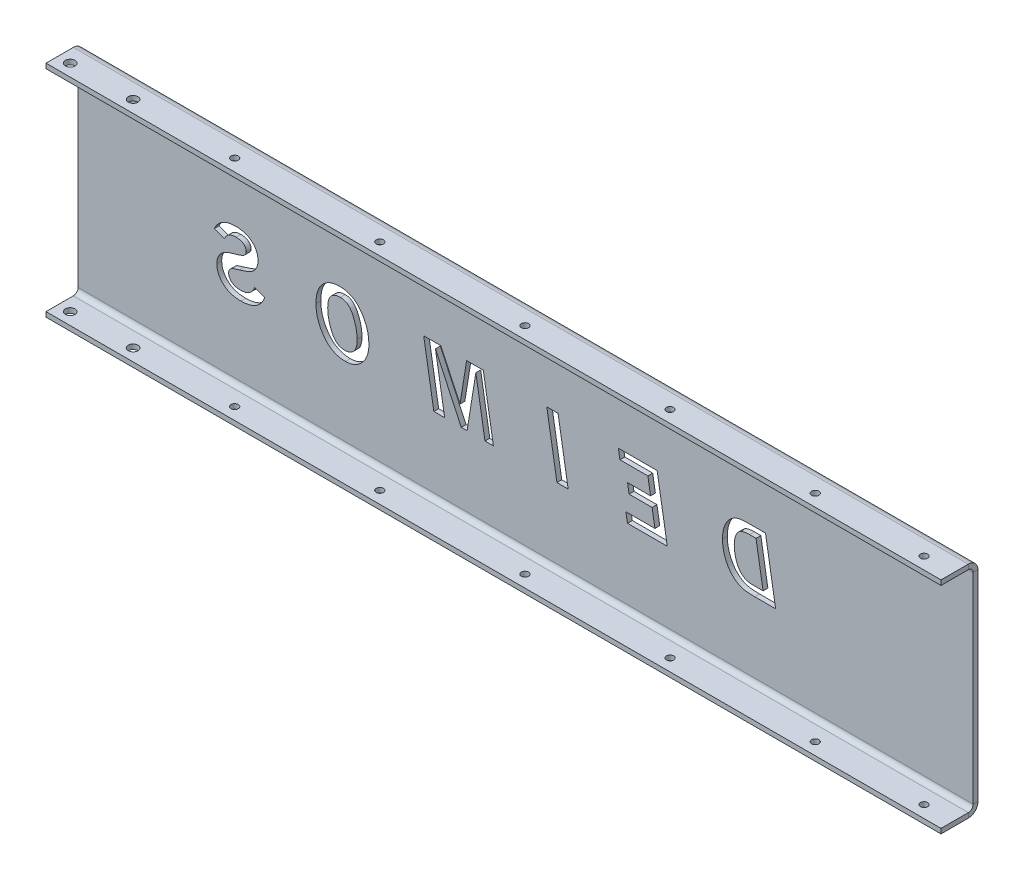
from build123d import *

# Parameters (mm, degrees)
SKETCH1_W                    = 370
SKETCH1_H                    = 114.96
BOSS_EXTRUDE1_DEPTH          = 2
SKETCH6_R                    = 1.5
SKETCH6_R_2                  = 2
CUT_EXTRUDE1_DEPTH           = 2
SKETCHED_START               = 45.05752
SKETCHED_BEND1_OUTLINE_W     = 370
SKETCHED_BEND1_OUTLINE_H     = 2
SKETCHED_BEND1_DEPTH         = 12.42248
SKETCHED_START_2             = -57.48
SKETCHED_BEND1_2_OUTLINE_W   = 370
SKETCHED_BEND1_2_OUTLINE_H   = 2
SKETCHED_BEND1_2_DEPTH       = 12.37752
SKETCHED_START_3             = -43.50248
SKETCHED_BEND1_3_OUTLINE_W   = 370
SKETCHED_BEND1_3_OUTLINE_H   = 13.28761102
SKETCHED_BEND1_3_OUTLINE_R   = 2
SKETCHED_BEND1_3_OUTLINE_R_2 = 1.5
SKETCHED_BEND1_3_DEPTH       = 0.02248
SKETCHED_START_4             = 41.48
SKETCHED_BEND1_4_OUTLINE_W   = 370
SKETCHED_BEND1_4_OUTLINE_H   = 13.28761102
SKETCHED_BEND1_4_OUTLINE_R   = 2
SKETCHED_BEND1_4_OUTLINE_R_2 = 1.5
SKETCHED_BEND1_4_DEPTH       = 4
SKETCHED_START_5             = -45.48
SKETCHED_BEND1_5_OUTLINE_W   = 370
SKETCHED_BEND1_5_OUTLINE_H   = 13.28761102
SKETCHED_BEND1_5_OUTLINE_R   = 2
SKETCHED_BEND1_5_OUTLINE_R_2 = 1.5
SKETCHED_BEND1_5_DEPTH       = 4
SKETCHED_START_6             = -185
SKETCHED_BEND1_6_DEPTH       = 370
CUT_EXTRUDE2_DEPTH           = 10


with BuildPart() as part:
    # Sketch1 → Boss-Extrude1 (new body)
    with BuildSketch(Plane.XY):
        Rectangle(SKETCH1_W, SKETCH1_H)
    extrude(amount=BOSS_EXTRUDE1_DEPTH)

    # Sketch6 → Cut-Extrude1 (cut)
    with BuildSketch(Plane.XY.offset(2)):
        with Locations((-112, 52.48)):
            Circle(SKETCH6_R)
        with Locations((-52, 52.48)):
            Circle(SKETCH6_R)
        with Locations((8, 52.48)):
            Circle(SKETCH6_R)
        with Locations((68, 52.48)):
            Circle(SKETCH6_R)
        with Locations((128, 52.48)):
            Circle(SKETCH6_R)
        with Locations((-180, 52.48)):
            Circle(SKETCH6_R_2)
        with Locations((-154, 52.48)):
            Circle(SKETCH6_R_2)
        with Locations((173, 52.48)):
            Circle(SKETCH6_R)
        with Locations(Location((173, -52.48, 0), (0, 0, 180))):
            Circle(SKETCH6_R)
        with Locations(Location((-154, -52.48, 0), (0, 0, 180))):
            Circle(SKETCH6_R_2)
        with Locations(Location((-180, -52.48, 0), (0, 0, 180))):
            Circle(SKETCH6_R_2)
        with Locations(Location((128, -52.48, 0), (0, 0, 180))):
            Circle(SKETCH6_R)
        with Locations(Location((68, -52.48, 0), (0, 0, 180))):
            Circle(SKETCH6_R)
        with Locations(Location((8, -52.48, 0), (0, 0, 180))):
            Circle(SKETCH6_R)
        with Locations(Location((-52, -52.48, 0), (0, 0, 180))):
            Circle(SKETCH6_R)
        with Locations(Location((-112, -52.48, 0), (0, 0, 180))):
            Circle(SKETCH6_R)
    extrude(amount=-CUT_EXTRUDE1_DEPTH, mode=Mode.SUBTRACT)

    # Sketched Bend1: read off the stored shape, not the designer's step
    # Sketched Bend1 outline → Sketched Bend1 (cut)
    with BuildSketch(Plane(origin=(0, 0, 0), x_dir=(1, 0, 0), z_dir=(0, 1, 0)).offset(SKETCHED_START)):
        with Locations((0, -1)):
            Rectangle(SKETCHED_BEND1_OUTLINE_W, SKETCHED_BEND1_OUTLINE_H)
    extrude(amount=SKETCHED_BEND1_DEPTH, mode=Mode.SUBTRACT)

    # Sketched Bend1 2 outline → Sketched Bend1 2 (cut)
    with BuildSketch(Plane(origin=(0, 0, 0), x_dir=(1, 0, 0), z_dir=(0, 1, 0)).offset(SKETCHED_START_2)):
        with Locations((0, -1)):
            Rectangle(SKETCHED_BEND1_2_OUTLINE_W, SKETCHED_BEND1_2_OUTLINE_H)
    extrude(amount=SKETCHED_BEND1_2_DEPTH, mode=Mode.SUBTRACT)

    # Sketched Bend1 3 outline → Sketched Bend1 3 (add)
    with BuildSketch(Plane(origin=(0, 0, 0), x_dir=(1, 0, 0), z_dir=(0, 1, 0)).offset(SKETCHED_START_3)):
        with Locations((0, -8.64380551)):
            Rectangle(SKETCHED_BEND1_3_OUTLINE_W, SKETCHED_BEND1_3_OUTLINE_H)
        with Locations((-180, -10.28761102)):
            Circle(SKETCHED_BEND1_3_OUTLINE_R, mode=Mode.SUBTRACT)
        with Locations((-154, -10.28761102)):
            Circle(SKETCHED_BEND1_3_OUTLINE_R, mode=Mode.SUBTRACT)
        with Locations((-112, -10.28761102)):
            Circle(SKETCHED_BEND1_3_OUTLINE_R_2, mode=Mode.SUBTRACT)
        with Locations((-52, -10.28761102)):
            Circle(SKETCHED_BEND1_3_OUTLINE_R_2, mode=Mode.SUBTRACT)
        with Locations((8, -10.28761102)):
            Circle(SKETCHED_BEND1_3_OUTLINE_R_2, mode=Mode.SUBTRACT)
        with Locations((68, -10.28761102)):
            Circle(SKETCHED_BEND1_3_OUTLINE_R_2, mode=Mode.SUBTRACT)
        with Locations((128, -10.28761102)):
            Circle(SKETCHED_BEND1_3_OUTLINE_R_2, mode=Mode.SUBTRACT)
        with Locations((173, -10.28761102)):
            Circle(SKETCHED_BEND1_3_OUTLINE_R_2, mode=Mode.SUBTRACT)
    extrude(amount=SKETCHED_BEND1_3_DEPTH)

    # Sketched Bend1 4 outline → Sketched Bend1 4 (add)
    with BuildSketch(Plane(origin=(0, 0, 0), x_dir=(1, 0, 0), z_dir=(0, 1, 0)).offset(SKETCHED_START_4)):
        with Locations((0, -8.64380551)):
            Rectangle(SKETCHED_BEND1_4_OUTLINE_W, SKETCHED_BEND1_4_OUTLINE_H)
        with Locations((-180, -10.28761102)):
            Circle(SKETCHED_BEND1_4_OUTLINE_R, mode=Mode.SUBTRACT)
        with Locations((-154, -10.28761102)):
            Circle(SKETCHED_BEND1_4_OUTLINE_R, mode=Mode.SUBTRACT)
        with Locations((-112, -10.28761102)):
            Circle(SKETCHED_BEND1_4_OUTLINE_R_2, mode=Mode.SUBTRACT)
        with Locations((-52, -10.28761102)):
            Circle(SKETCHED_BEND1_4_OUTLINE_R_2, mode=Mode.SUBTRACT)
        with Locations((8, -10.28761102)):
            Circle(SKETCHED_BEND1_4_OUTLINE_R_2, mode=Mode.SUBTRACT)
        with Locations((68, -10.28761102)):
            Circle(SKETCHED_BEND1_4_OUTLINE_R_2, mode=Mode.SUBTRACT)
        with Locations((128, -10.28761102)):
            Circle(SKETCHED_BEND1_4_OUTLINE_R_2, mode=Mode.SUBTRACT)
        with Locations((173, -10.28761102)):
            Circle(SKETCHED_BEND1_4_OUTLINE_R_2, mode=Mode.SUBTRACT)
    extrude(amount=SKETCHED_BEND1_4_DEPTH)

    # Sketched Bend1 5 outline → Sketched Bend1 5 (add)
    with BuildSketch(Plane(origin=(0, 0, 0), x_dir=(1, 0, 0), z_dir=(0, 1, 0)).offset(SKETCHED_START_5)):
        with Locations((0, -8.64380551)):
            Rectangle(SKETCHED_BEND1_5_OUTLINE_W, SKETCHED_BEND1_5_OUTLINE_H)
        with Locations((-180, -10.28761102)):
            Circle(SKETCHED_BEND1_5_OUTLINE_R, mode=Mode.SUBTRACT)
        with Locations((-154, -10.28761102)):
            Circle(SKETCHED_BEND1_5_OUTLINE_R, mode=Mode.SUBTRACT)
        with Locations((-112, -10.28761102)):
            Circle(SKETCHED_BEND1_5_OUTLINE_R_2, mode=Mode.SUBTRACT)
        with Locations((-52, -10.28761102)):
            Circle(SKETCHED_BEND1_5_OUTLINE_R_2, mode=Mode.SUBTRACT)
        with Locations((8, -10.28761102)):
            Circle(SKETCHED_BEND1_5_OUTLINE_R_2, mode=Mode.SUBTRACT)
        with Locations((68, -10.28761102)):
            Circle(SKETCHED_BEND1_5_OUTLINE_R_2, mode=Mode.SUBTRACT)
        with Locations((128, -10.28761102)):
            Circle(SKETCHED_BEND1_5_OUTLINE_R_2, mode=Mode.SUBTRACT)
        with Locations((173, -10.28761102)):
            Circle(SKETCHED_BEND1_5_OUTLINE_R_2, mode=Mode.SUBTRACT)
    extrude(amount=SKETCHED_BEND1_5_DEPTH)

    # Sketched Bend1 6 outline → Sketched Bend1 6 (cut)
    with BuildSketch(Plane.YZ.offset(SKETCHED_START_6)):
        with BuildLine():
            Line((-41.48, 15.28761102), (-43.48, 15.28761102))
            Line((-43.48, 15.28761102), (-43.48, 4))
            ThreePointArc((-43.48, 4), (-42.894213562, 2.585786438), (-41.48, 2))
            Line((-41.48, 2), (-41.48, 15.28761102))
        make_face()
        with BuildLine():
            Line((-45.10248, 0), (-41.48, 0))
            ThreePointArc((-41.48, 0), (-44.308427125, 1.171572875), (-45.48, 4))
            Line((-45.48, 4), (-45.48, 2))
            Line((-45.48, 2), (-45.10248, 2))
            Line((-45.10248, 2), (-45.10248, 0))
        make_face()
        with BuildLine():
            Line((45.48, 2), (45.48, 4))
            ThreePointArc((45.48, 4), (44.308427125, 1.171572875), (41.48, 0))
            Line((41.48, 0), (45.05752, 0))
            Line((45.05752, 0), (45.05752, 2))
            Line((45.05752, 2), (45.48, 2))
        make_face()
        with BuildLine():
            ThreePointArc((41.48, 2), (42.894213562, 2.585786438), (43.48, 4))
            Line((43.48, 4), (43.48, 15.28761102))
            Line((43.48, 15.28761102), (41.48, 15.28761102))
            Line((41.48, 15.28761102), (41.48, 2))
        make_face()
    extrude(amount=SKETCHED_BEND1_6_DEPTH, mode=Mode.SUBTRACT)

    # Sketch9 → Cut-Extrude2 (cut)
    # profile 1 of 6: a face of its own
    with BuildSketch(Plane(origin=(0, 0, 0), x_dir=(-1, 0, 0), z_dir=(0, 0, -1))):
        with BuildLine():
            Line((-103.333373446, -12.355387634), (-99.150430738, 12.644612366))
            Line((-99.150430738, 12.644612366), (-91.777383863, 12.644612366))
            add(Edge.make_bspline(
                [(-91.777383863, 12.644612366), (-91.372095943, 12.640604528), (-90.602074955, 12.632989893), (-89.507882373, 12.544455465), (-88.536384929, 12.410582481), (-87.667300905, 12.208827265), (-86.86880803, 11.919185976), (-86.102674711, 11.52833503), (-85.352349299, 11.03024478), (-84.618985787, 10.427754808), (-83.92128798, 9.713049323), (-83.294458798, 8.867355234), (-82.743710544, 7.898930135), (-82.257780501, 6.821315334), (-81.851435575, 5.639900668), (-81.579066505, 4.359084196), (-81.39675362, 2.994549803), (-81.380124839, 2.054972557), (-81.37156789, 1.571478686)],
                knots=[0, 0, 0, 0, 1.118870544, 2.125782091, 3.02903713, 3.824810156, 4.584659149, 5.368544991, 6.194019643, 7.066791694, 7.984983464, 8.944777353, 9.964926002, 11.055581011, 12.205220283, 13.407129518, 14.665743566, 16, 16, 16, 16], degree=3))
            add(Edge.make_bspline(
                [(-81.37156789, 1.571478686), (-81.376252418, 1.282045734), (-81.385572665, 0.706195403), (-81.444583045, -0.150618191), (-81.55063267, -0.993666314), (-81.686471101, -1.824796868), (-81.882214569, -2.637211454), (-82.10176863, -3.439233604), (-82.368686634, -4.226984517), (-82.676773761, -4.994879353), (-83.010096617, -5.736116487), (-83.370250794, -6.433902784), (-83.737296231, -7.094298729), (-84.126293506, -7.708341363), (-84.542819875, -8.273221917), (-84.967635639, -8.800402662), (-85.414613033, -9.279878155), (-86.019914425, -9.846209473), (-86.782223702, -10.463239523), (-87.708034062, -11.077662482), (-88.622409362, -11.552732676), (-89.39712994, -11.831123131), (-90.035490434, -11.981819426), (-90.552258527, -12.086841382), (-91.120024363, -12.163726091), (-91.732874198, -12.236113286), (-92.3952409, -12.289427227), (-93.106335072, -12.324609275), (-93.865880554, -12.355687905), (-94.388748179, -12.355489761), (-94.658243238, -12.355387634)],
                knots=[0, 0, 0, 0, 1.109274789, 2.206992162, 3.289307393, 4.364922295, 5.43246829, 6.490182234, 7.550979898, 8.617918265, 9.660145882, 10.664442752, 11.626427069, 12.555076936, 13.447833094, 14.314876134, 15.148533775, 15.957539771, 17.490250216, 18.901208968, 20.209277333, 21.430298952, 22.043860887, 22.722124047, 23.450386116, 24.238732461, 25.087126029, 25.996356372, 26.967287261, 28, 28, 28, 28], degree=3))
            Line((-94.658243238, -12.355387634), (-103.333373446, -12.355387634))
        make_face()
        with BuildLine():
            Line((-98.141316154, -8.535943189), (-94.159111293, -8.535943189))
            add(Edge.make_bspline(
                [(-94.159111293, -8.535943189), (-93.84416243, -8.530392997), (-93.245141008, -8.51983673), (-92.394965034, -8.422722907), (-91.642519384, -8.264936112), (-90.972241325, -8.034079072), (-90.366162201, -7.708185737), (-89.774796569, -7.315378243), (-89.214120241, -6.808498658), (-88.644625843, -6.230643804), (-88.115496016, -5.523169032), (-87.642900599, -4.67873861), (-87.238525838, -3.695411501), (-86.880166271, -2.602258025), (-86.591752116, -1.430582672), (-86.388635831, -0.220738734), (-86.258201146, 1.006206306), (-86.241223264, 1.829760939), (-86.232679001, 2.244221741)],
                knots=[0, 0, 0, 0, 0.996978223, 1.896216764, 2.7049113, 3.42754481, 4.131909927, 4.878381725, 5.669717774, 6.520192559, 7.444427195, 8.457280282, 9.576134715, 10.805702254, 12.097335228, 13.392720083, 14.687864434, 16, 16, 16, 16], degree=3))
            add(Edge.make_bspline(
                [(-86.232679001, 2.244221741), (-86.240554911, 2.570229823), (-86.256022106, 3.210464559), (-86.390955442, 4.143899187), (-86.598124164, 5.031760205), (-86.902294333, 5.854946024), (-87.272005896, 6.608844057), (-87.740886531, 7.251126236), (-88.294360669, 7.774035369), (-88.935617195, 8.18015278), (-89.678940548, 8.471808179), (-90.526899873, 8.680773071), (-91.493611557, 8.802100756), (-92.176694755, 8.817203294), (-92.536932474, 8.825167922)],
                knots=[0, 0, 0, 0, 1.115751648, 2.191181755, 3.223028885, 4.23195157, 5.190170781, 6.089364625, 6.939250992, 7.782751402, 8.671651249, 9.661406867, 10.766695684, 12, 12, 12, 12], degree=3))
            Line((-92.536932474, 8.825167922), (-95.233330043, 8.825167922))
            Line((-95.233330043, 8.825167922), (-98.141316154, -8.535943189))
        make_face(mode=Mode.SUBTRACT)
    # profile 2 of 6: a face of its own
    with BuildSketch(Plane(origin=(0, 0, 0), x_dir=(-1, 0, 0), z_dir=(0, 0, -1))):
        Polygon((-42.102904696, -12.355387634), (-58.541706779, -12.355387634), (-54.358764071, 12.644612366), (-38.316012335, 12.644612366), (-38.977904696, 8.825167922), (-50.533894279, 8.825167922), (-51.635239765, 2.2279457), (-42.135456779, 2.2279457), (-42.75937171, -1.591498745), (-52.27000539, -1.591498745), (-53.436455043, -8.535943189), (-41.441012335, -8.535943189), align=None)
    # profile 3 of 6: a face of its own
    with BuildSketch(Plane(origin=(0, 0, 0), x_dir=(-1, 0, 0), z_dir=(0, 0, -1))):
        Polygon((-12.936238029, -12.355387634), (-17.569484557, -12.355387634), (-13.386541849, 12.644612366), (-8.753295321, 12.644612366), align=None)
    # profile 4 of 6: a face of its own
    with BuildSketch(Plane(origin=(0, 0, 0), x_dir=(-1, 0, 0), z_dir=(0, 0, -1))):
        Polygon((37.953518915, -12.355387634), (33.47218211, -12.355387634), (37.286201207, 10.409369311), (26.63624461, -12.355387634), (24.200263707, -12.355387634), (20.592407804, 10.208631463), (16.816366137, -12.355387634), (13.333293221, -12.355387634), (17.516235929, 12.644612366), (24.411852249, 12.644612366), (27.135376554, -4.287896314), (35.045532804, 12.644612366), (42.141886971, 12.644612366), align=None)
    # profile 5 of 6: a face of its own
    with BuildSketch(Plane(origin=(0, 0, 0), x_dir=(-1, 0, 0), z_dir=(0, 0, -1))):
        with BuildLine():
            add(Edge.make_bspline(
                [(64.808987665, -1.683729648), (64.817213793, -1.222089744), (64.833521756, -0.306907504), (64.998944666, 1.045776381), (65.252276067, 2.366663345), (65.609537215, 3.654022824), (66.076862407, 4.906697791), (66.631711125, 6.132163365), (67.30732679, 7.314784282), (67.936063798, 8.27050368), (68.491276669, 8.997757319), (68.923002828, 9.51635324), (69.381910462, 9.990433785), (69.846552118, 10.440875472), (70.337886581, 10.845802333), (70.840943672, 11.222146041), (71.36546343, 11.55996275), (71.905591233, 11.862099433), (72.462379369, 12.131728264), (73.038700152, 12.35737877), (73.630904365, 12.553166418), (74.2389802, 12.716964204), (74.865985449, 12.842660446), (75.509672225, 12.925929124), (76.170394645, 12.984522579), (76.61621847, 12.989373478), (76.842407804, 12.991834588)],
                knots=[0, 0, 0, 0, 1.573759098, 3.11991309, 4.640401397, 6.157784159, 7.67014454, 9.196388864, 10.740216044, 12.310575267, 13.093905576, 13.859925972, 14.610266845, 15.343167476, 16.065744126, 16.779980783, 17.484835054, 18.191737227, 18.889676342, 19.592909635, 20.300914138, 21.016055667, 21.739395293, 22.479963726, 23.228807494, 24, 24, 24, 24], degree=3))
            add(Edge.make_bspline(
                [(76.842407804, 12.991834588), (77.213670065, 12.984940904), (77.940938554, 12.971436812), (78.999029229, 12.823698028), (79.999696466, 12.602834891), (80.933671555, 12.270326313), (81.811915915, 11.860902857), (82.628629066, 11.351528692), (83.378332163, 10.744316441), (84.068918922, 10.054479533), (84.686967092, 9.285665731), (85.22063319, 8.440907762), (85.680106708, 7.53252566), (86.046246456, 6.550446697), (86.334347851, 5.502851144), (86.539854915, 4.386760385), (86.657508473, 3.201616686), (86.675017946, 2.38915879), (86.683987665, 1.97295438)],
                knots=[0, 0, 0, 0, 1.065001061, 2.086238741, 3.060922607, 4.001671949, 4.925890787, 5.83767763, 6.757043512, 7.689405277, 8.634712547, 9.582297668, 10.552714363, 11.551580765, 12.58556343, 13.667883125, 14.805307533, 16, 16, 16, 16], degree=3))
            add(Edge.make_bspline(
                [(86.683987665, 1.97295438), (86.672889182, 1.500562848), (86.65097465, 0.567801219), (86.496789679, -0.813319007), (86.237239841, -2.152235324), (85.872203004, -3.454023826), (85.397716145, -4.711517445), (84.827603896, -5.935146321), (84.144011002, -7.113514251), (83.373703258, -8.244062089), (82.516325113, -9.286637179), (81.576627081, -10.201357963), (80.570780403, -10.978339445), (79.488752025, -11.609556764), (78.337620838, -12.098028065), (77.118692161, -12.45460111), (75.829552682, -12.662115161), (74.947897679, -12.688940984), (74.498657804, -12.702609856)],
                knots=[0, 0, 0, 0, 1.067275265, 2.107390477, 3.135557925, 4.145869336, 5.158326906, 6.169200059, 7.192492238, 8.23295253, 9.257345501, 10.236946766, 11.189902968, 12.121999753, 13.059339325, 14.008477033, 14.985236258, 16, 16, 16, 16], degree=3))
            add(Edge.make_bspline(
                [(74.498657804, -12.702609856), (74.167165612, -12.693302311), (73.515580006, -12.675007272), (72.557882919, -12.527972058), (71.637876869, -12.298483198), (70.755785667, -11.963045086), (69.914939689, -11.530827175), (69.105078591, -11.015580528), (68.342629563, -10.393298098), (67.620813086, -9.68932783), (66.960901377, -8.905828499), (66.381518795, -8.056592465), (65.8977288, -7.141136028), (65.494293721, -6.168726377), (65.184432556, -5.132290046), (64.97299199, -4.036045088), (64.830223638, -2.881050227), (64.816180499, -2.089273946), (64.808987665, -1.683729648)],
                knots=[0, 0, 0, 0, 0.968850214, 1.90438529, 2.826508979, 3.736914159, 4.656851998, 5.586811226, 6.538172809, 7.52909527, 8.531129654, 9.528450991, 10.529103133, 11.553327303, 12.602260473, 13.685964741, 14.814761407, 16, 16, 16, 16], degree=3))
        make_face()
        with BuildLine():
            add(Edge.make_bspline(
                [(69.670098776, -2.405300828), (69.673334396, -2.685808574), (69.679587231, -3.227889781), (69.753573286, -4.010348065), (69.860231842, -4.732143062), (70.029387699, -5.388341277), (70.220085558, -5.988561019), (70.480918289, -6.519166119), (70.778799755, -6.990755391), (71.121856889, -7.39978131), (71.502123639, -7.746473178), (71.897281097, -8.0535194), (72.316534797, -8.308638716), (72.755060922, -8.516754678), (73.213210155, -8.679936622), (73.690737527, -8.799422968), (74.188957557, -8.872465554), (74.527343466, -8.879558835), (74.699395651, -8.883165412)],
                knots=[0, 0, 0, 0, 1.447676477, 2.797634734, 4.054805158, 5.209696084, 6.293280948, 7.299658497, 8.252783695, 9.167307702, 10.046003553, 10.905034352, 11.747309712, 12.57423076, 13.407034449, 14.253954461, 15.11222382, 16, 16, 16, 16], degree=3))
            add(Edge.make_bspline(
                [(74.699395651, -8.883165412), (74.996982758, -8.872529556), (75.576174898, -8.851829048), (76.412614478, -8.666366893), (77.190034676, -8.368059182), (77.900694435, -7.936011719), (78.556362983, -7.39200837), (79.141437067, -6.722269639), (79.667523101, -5.936066211), (80.112769571, -5.040871209), (80.511595315, -4.090413823), (80.857506787, -3.116077756), (81.159591696, -2.136275186), (81.404144025, -1.145741683), (81.585898516, -0.144831851), (81.723608474, 0.861331688), (81.807263655, 1.877488728), (81.817658773, 2.558738573), (81.822876554, 2.900688755)],
                knots=[0, 0, 0, 0, 0.93600307, 1.821737598, 2.68359088, 3.546910317, 4.428406109, 5.356249367, 6.337050341, 7.399063124, 8.498994311, 9.581511397, 10.653311122, 11.726456371, 12.791990027, 13.85505572, 14.923355224, 16, 16, 16, 16], degree=3))
            add(Edge.make_bspline(
                [(81.822876554, 2.900688755), (81.818423716, 3.153974697), (81.809791335, 3.645000969), (81.751620428, 4.35762682), (81.648048498, 5.020828279), (81.509355756, 5.636822512), (81.327078312, 6.203111133), (81.095690718, 6.717462901), (80.831237659, 7.186275274), (80.525741176, 7.608576486), (80.177886171, 7.981548062), (79.780991047, 8.296355341), (79.351154811, 8.569695206), (78.880542, 8.79569221), (78.364549755, 8.959936963), (77.811597532, 9.087117542), (77.21479708, 9.154937233), (76.804580586, 9.166448466), (76.592841832, 9.172390144)],
                knots=[0, 0, 0, 0, 1.300945398, 2.522044307, 3.668923192, 4.745969177, 5.762304915, 6.718632703, 7.638024018, 8.522401645, 9.389787, 10.248575261, 11.117004432, 12.001967222, 12.921358537, 13.892591731, 14.91223291, 16, 16, 16, 16], degree=3))
            add(Edge.make_bspline(
                [(76.592841832, 9.172390144), (76.309629744, 9.162067946), (75.756705354, 9.141915576), (74.956916225, 8.950125123), (74.213416915, 8.638377477), (73.528732351, 8.195800065), (72.89763067, 7.634217955), (72.326812753, 6.946102532), (71.809192791, 6.137205434), (71.371347818, 5.218342018), (70.978428484, 4.251209723), (70.632806138, 3.274268394), (70.329569189, 2.309830255), (70.093910539, 1.35019718), (69.898358879, 0.401098313), (69.773267014, -0.543743983), (69.685572365, -1.477728817), (69.675230696, -2.097665347), (69.670098776, -2.405300828)],
                knots=[0, 0, 0, 0, 0.91496056, 1.786307967, 2.6436562, 3.511934087, 4.411273141, 5.366374337, 6.395299342, 7.509943253, 8.653987148, 9.771682426, 10.861670718, 11.923067874, 12.967200101, 13.994843516, 15.004967042, 16, 16, 16, 16], degree=3))
        make_face(mode=Mode.SUBTRACT)
    # profile 6 of 6: a face of its own
    with BuildSketch(Plane(origin=(0, 0, 0), x_dir=(-1, 0, 0), z_dir=(0, 0, -1))):
        with BuildLine():
            Line((128.697876554, 7.783501255), (124.531209887, 6.264404033))
            add(Edge.make_bspline(
                [(124.531209887, 6.264404033), (124.415122796, 6.496363838), (124.188929698, 6.948332321), (123.741442022, 7.543719043), (123.233045405, 8.053249487), (122.648706571, 8.462125371), (122.000932385, 8.787712843), (121.282831565, 9.012624685), (120.498316521, 9.151364845), (119.952829821, 9.165212678), (119.670098776, 9.172390144)],
                knots=[0, 0, 0, 0, 1.031435413, 2.009728797, 2.952113402, 3.887533662, 4.837924238, 5.828945682, 6.874721501, 8, 8, 8, 8], degree=3))
            add(Edge.make_bspline(
                [(119.670098776, 9.172390144), (119.360009993, 9.163555239), (118.769092479, 9.146719092), (117.936843502, 8.978466408), (117.209326981, 8.701665011), (116.597653464, 8.318211101), (116.115491019, 7.848185731), (115.759267508, 7.320416692), (115.543434538, 6.730530308), (115.516887435, 6.316778103), (115.50343211, 6.107068963)],
                knots=[0, 0, 0, 0, 1.286724725, 2.452033786, 3.508033105, 4.504170805, 5.428466921, 6.284754455, 7.130632626, 8, 8, 8, 8], degree=3))
            add(Edge.make_bspline(
                [(115.50343211, 6.107068963), (115.511951541, 5.94482373), (115.528512262, 5.629439084), (115.683194107, 5.184259071), (115.928546627, 4.78506888), (116.286697147, 4.435806078), (116.757785197, 4.126452761), (117.345185351, 3.837908696), (118.053760798, 3.554524193), (118.576314758, 3.397270778), (118.856296693, 3.313015144)],
                knots=[0, 0, 0, 0, 0.823036976, 1.599881986, 2.368400678, 3.188139722, 4.12213369, 5.224873081, 6.513100149, 8, 8, 8, 8], degree=3))
            Line((118.856296693, 3.313015144), (122.24171336, 2.298475213))
            add(Edge.make_bspline(
                [(122.24171336, 2.298475213), (122.483518962, 2.220737557), (122.970679562, 2.064121156), (123.680909288, 1.76142763), (124.367348397, 1.384508349), (125.035735546, 0.966520127), (125.652749563, 0.481699223), (126.199097334, -0.063317098), (126.650133699, -0.677363726), (127.018078958, -1.340638073), (127.306010224, -2.03830495), (127.504679442, -2.762173485), (127.637592904, -3.5017458), (127.649985667, -4.003393476), (127.656209887, -4.255344231)],
                knots=[0, 0, 0, 0, 0.995925587, 2.006470081, 3.022055472, 4.064942404, 5.095185167, 6.093305899, 7.082108134, 8.072816631, 9.062051275, 10.034434753, 11.012801869, 12, 12, 12, 12], degree=3))
            add(Edge.make_bspline(
                [(127.656209887, -4.255344231), (127.649481425, -4.536082091), (127.636178587, -5.091128704), (127.512911563, -5.909468519), (127.312012281, -6.697975381), (127.033856827, -7.45874696), (126.673314885, -8.189643442), (126.230033376, -8.890568576), (125.713474208, -9.566797928), (125.116402234, -10.205152303), (124.449247405, -10.798071806), (123.698493658, -11.311895512), (122.871916753, -11.741125761), (121.9727988, -12.092301698), (121.003134252, -12.370175378), (119.960106504, -12.561152728), (118.844784134, -12.684190296), (118.075392367, -12.69634676), (117.678996346, -12.702609856)],
                knots=[0, 0, 0, 0, 0.916904786, 1.812811761, 2.697144998, 3.572109026, 4.454821699, 5.354967423, 6.278078418, 7.231394976, 8.207033945, 9.188881328, 10.195959938, 11.243957896, 12.338171697, 13.486758559, 14.705160426, 16, 16, 16, 16], degree=3))
            add(Edge.make_bspline(
                [(117.678996346, -12.702609856), (117.369657423, -12.696528571), (116.764641636, -12.684634583), (115.877867992, -12.617277266), (115.034696995, -12.488345364), (114.229419176, -12.326255478), (113.469944417, -12.09948386), (112.748074669, -11.838163438), (112.075187956, -11.512314365), (111.43470379, -11.152823586), (110.844662532, -10.729306525), (110.285180904, -10.269794364), (109.777347591, -9.751377185), (109.306160137, -9.188168085), (108.878156179, -8.57715305), (108.498636747, -7.911363988), (108.147739165, -7.205974062), (107.959724612, -6.70581353), (107.864543221, -6.452609856)],
                knots=[0, 0, 0, 0, 1.185777418, 2.319184575, 3.405316595, 4.453427149, 5.464581621, 6.440532792, 7.392359292, 8.326892075, 9.251917034, 10.172229554, 11.098577998, 12.028653176, 12.984333292, 13.953268827, 14.963852965, 16, 16, 16, 16], degree=3))
            Line((107.864543221, -6.452609856), (112.031209887, -5.009467495))
            add(Edge.make_bspline(
                [(112.031209887, -5.009467495), (112.157826872, -5.315953886), (112.40321443, -5.909933814), (112.910932719, -6.705270251), (113.505077227, -7.385058721), (114.203118156, -7.933796013), (114.984899211, -8.369985074), (115.866508359, -8.664102936), (116.831714046, -8.854115087), (117.508034314, -8.873258578), (117.858032804, -8.883165412)],
                knots=[0, 0, 0, 0, 1.057309691, 2.04909827, 2.998284376, 3.927331304, 4.870877932, 5.84256927, 6.883520819, 8, 8, 8, 8], degree=3))
            add(Edge.make_bspline(
                [(117.858032804, -8.883165412), (118.060703717, -8.880665504), (118.452369242, -8.875834383), (119.020142445, -8.821122172), (119.547617651, -8.728789263), (120.036139624, -8.605442651), (120.484920348, -8.449926813), (120.890841338, -8.252945426), (121.256004218, -8.018571159), (121.681780973, -7.670184173), (122.11806483, -7.18206929), (122.510662942, -6.542611337), (122.751477977, -5.856159587), (122.78056474, -5.382019085), (122.795098776, -5.145101175)],
                knots=[0, 0, 0, 0, 1.052044298, 2.033096294, 2.957797347, 3.83004638, 4.646750466, 5.419464388, 6.167007734, 6.894405689, 8.270752691, 9.542934809, 10.772256858, 12, 12, 12, 12], degree=3))
            add(Edge.make_bspline(
                [(122.795098776, -5.145101175), (122.790319671, -5.010855138), (122.780913751, -4.7466409), (122.694289097, -4.36555128), (122.542016677, -4.015923125), (122.341712837, -3.696357368), (122.094805942, -3.410116586), (121.819919102, -3.151767249), (121.504177186, -2.939774806), (121.214126919, -2.788898619), (120.950352126, -2.676076889), (120.708466172, -2.582043808), (120.420927123, -2.487468824), (120.090129319, -2.378553992), (119.716475639, -2.25867141), (119.297003581, -2.133273687), (118.832600569, -2.006293213), (118.509017665, -1.915412004), (118.340888707, -1.868191453)],
                knots=[0, 0, 0, 0, 1.069571466, 2.105060347, 3.093489376, 4.097781034, 5.100414759, 6.100556433, 7.096530831, 8.122131743, 8.703452283, 9.383679482, 10.190857234, 11.116599927, 12.160987588, 13.319866355, 14.607441637, 16, 16, 16, 16], degree=3))
            add(Edge.make_bspline(
                [(118.340888707, -1.868191453), (118.101847241, -1.800570208), (117.638773351, -1.669573552), (116.972450475, -1.461614746), (116.351115267, -1.261957356), (115.775840344, -1.061225079), (115.247440114, -0.862601121), (114.767043083, -0.665247476), (114.331506633, -0.476516837), (113.813753764, -0.228585313), (113.227945342, 0.129713076), (112.59103, 0.63611775), (112.029687092, 1.23669226), (111.533306213, 1.910812282), (111.135391714, 2.671086493), (110.845928679, 3.501965795), (110.677096601, 4.40216621), (110.654123452, 5.023093607), (110.642320999, 5.342095005)],
                knots=[0, 0, 0, 0, 1.031910273, 1.999028497, 2.89942089, 3.742853575, 4.529793703, 5.244065031, 5.90005761, 6.501472447, 7.627531612, 8.744457254, 9.871067586, 11.032603011, 12.212074545, 13.421385117, 14.67523682, 16, 16, 16, 16], degree=3))
            add(Edge.make_bspline(
                [(110.642320999, 5.342095005), (110.648950766, 5.615620318), (110.662012819, 6.154523396), (110.784896012, 6.942017225), (110.981457438, 7.692700759), (111.2505759, 8.40686646), (111.608046943, 9.078629655), (112.041440173, 9.711531477), (112.54594262, 10.312558815), (113.134968027, 10.861429035), (113.78187196, 11.369009747), (114.498529386, 11.801374224), (115.265757765, 12.173197607), (116.092054485, 12.470942871), (116.972810344, 12.70328201), (117.910859229, 12.869652028), (118.904490701, 12.975765843), (119.586630972, 12.986392764), (119.93594079, 12.991834588)],
                knots=[0, 0, 0, 0, 0.969854219, 1.910819212, 2.819649808, 3.719284426, 4.611867661, 5.512325533, 6.436516975, 7.389630966, 8.363699246, 9.348526858, 10.35288987, 11.383968843, 12.459349986, 13.580679935, 14.761116609, 16, 16, 16, 16], degree=3))
            add(Edge.make_bspline(
                [(119.93594079, 12.991834588), (120.196455464, 12.987293185), (120.707325341, 12.978387483), (121.457704039, 12.919553107), (122.174744408, 12.815303493), (122.862463432, 12.676072531), (123.518039676, 12.490607533), (124.146529348, 12.268866626), (124.742330687, 12.002116287), (125.310294875, 11.699068208), (125.842089394, 11.349835866), (126.34528384, 10.962526), (126.816179151, 10.533589618), (127.259150957, 10.065574186), (127.664309683, 9.552193433), (128.046746991, 9.003654336), (128.394369653, 8.411913607), (128.595844341, 7.994759393), (128.697876554, 7.783501255)],
                knots=[0, 0, 0, 0, 1.153038739, 2.261111632, 3.328545195, 4.35831264, 5.364320162, 6.341544957, 7.3054026, 8.250838639, 9.187697573, 10.117865185, 11.058477712, 12.004083144, 12.966610502, 13.950206545, 14.961929343, 16, 16, 16, 16], degree=3))
        make_face()
    extrude(amount=-CUT_EXTRUDE2_DEPTH, mode=Mode.SUBTRACT)


with BuildPart() as cut_extrude2_piece_1:
    # of the separate pieces the step leaves, piece 1, a body of its own (cut_extrude2_pieces)
    add(part.part.solids().sort_by_distance((-185, -41.48, 0))[0])


with BuildPart() as cut_extrude2_piece_2:
    # of the separate pieces the step leaves, piece 2, a body of its own (cut_extrude2_pieces)
    add(part.part.solids().sort_by_distance((-76.592841832, 9.172390144, 0))[0])


with BuildPart() as cut_extrude2_piece_3:
    # of the separate pieces the step leaves, piece 3, a body of its own (cut_extrude2_pieces)
    add(part.part.solids().sort_by_distance((95.233330043, 8.825167922, 0))[0])


solid = Compound([cut_extrude2_piece_1.part, cut_extrude2_piece_2.part, cut_extrude2_piece_3.part])
